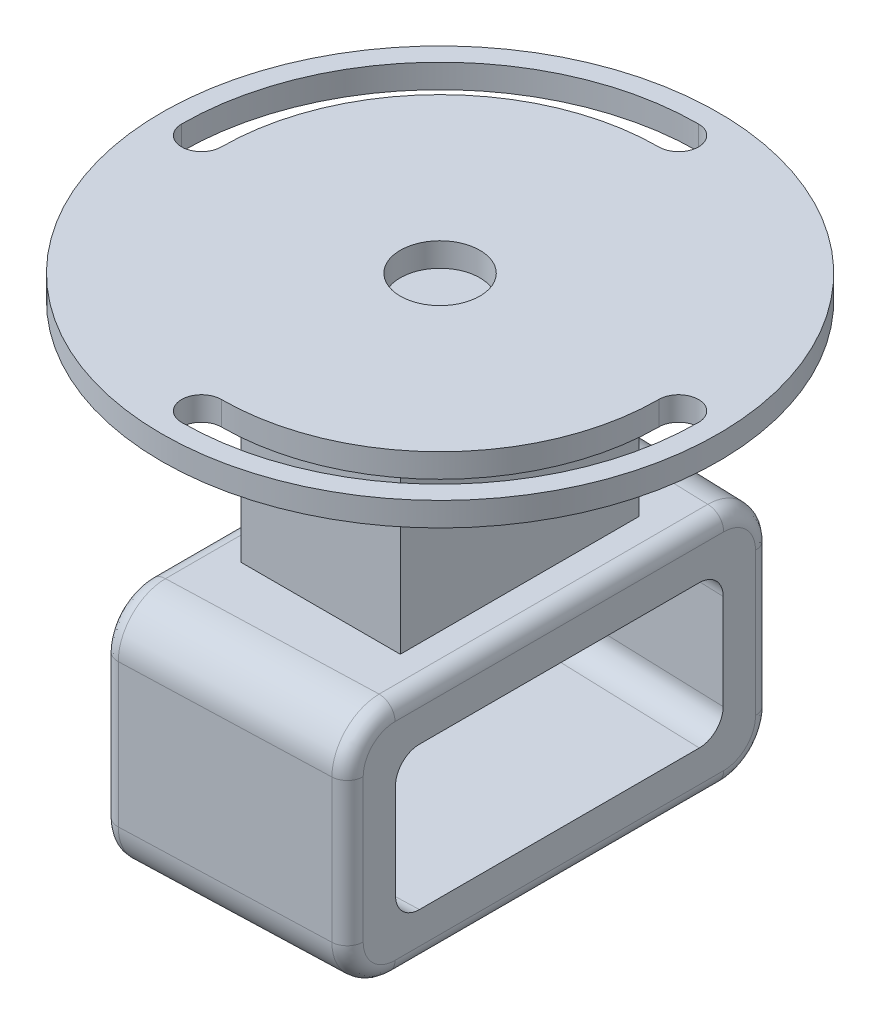
from build123d import *

# Parameters (mm, degrees)
SKETCH_1_R      = 35
SKETCH_1_R_2    = 5
EXTRUDE_1_DEPTH = 3
SKETCH_2_W      = 20
SKETCH_2_H      = 30
EXTRUDE_2_DEPTH = 26
EXTRUDE_4_DEPTH = 6
EXTRUDE_5_DEPTH = 30
EXTRUDE_START   = 30
EXTRUDE_6_DEPTH = 6
FILLET_1_R      = 3
FILLET_2_R      = 6
FILLET_3_R      = 2


with BuildPart() as part:
    # 스케치1 → 보스-돌출1 (new body)
    with BuildSketch(Plane(origin=(0, 0, 0), x_dir=(1, 0, 0), z_dir=(0, 1, 0))):
        with Locations(Location((0, 0, 0), (0, 0, 270))):
            Circle(SKETCH_1_R)
        with Locations(Location((0, 0, 0), (0, 0, 270))):
            Circle(SKETCH_1_R_2, mode=Mode.SUBTRACT)
        with BuildLine():
            ThreePointArc((0, 27.5), (2.5, 30), (0, 32.5))
            ThreePointArc((0, 32.5), (-22.980970389, 22.980970389), (-32.5, 0))
            ThreePointArc((-32.5, 0), (-30, -2.5), (-27.5, 0))
            ThreePointArc((-27.5, 0), (-19.445436483, 19.445436483), (0, 27.5))
        make_face(mode=Mode.SUBTRACT)
        with BuildLine():
            ThreePointArc((32.5, 0), (30, 2.5), (27.5, 0))
            ThreePointArc((27.5, 0), (19.445436483, -19.445436483), (0, -27.5))
            ThreePointArc((0, -27.5), (-2.5, -30), (0, -32.5))
            ThreePointArc((0, -32.5), (22.980970389, -22.980970389), (32.5, 0))
        make_face(mode=Mode.SUBTRACT)
    extrude(amount=EXTRUDE_1_DEPTH)

    # 스케치2 → 보스-돌출2 (add)
    with BuildSketch(Plane.XZ):
        Rectangle(SKETCH_2_W, SKETCH_2_H)
    extrude(amount=EXTRUDE_2_DEPTH)

    # 스케치5 → 보스-돌출4 (add)
    with BuildSketch(Plane.XZ.offset(26)):
        Polygon((15, 20.6), (15, -20.6), (-15, -21.6), (-15, 21.6), align=None)
    extrude(amount=EXTRUDE_4_DEPTH)

    # 스케치6 → 보스-돌출5 (add)
    with BuildSketch(Plane(origin=(0, -26, 0), x_dir=(1, 0, 0), z_dir=(0, 1, 0))):
        Polygon((-15, -21.6), (-15, -27.6), (15, -26.6), (15, -20.6), align=None)
        Polygon((-15, 21.6), (-15, 27.6), (15, 26.6), (15, 20.6), align=None)
    extrude(amount=-EXTRUDE_5_DEPTH)

    # 스케치5<2> → 보스-돌출6 (add)
    with BuildSketch(Plane.XZ.offset(26).offset(EXTRUDE_START)):
        Polygon((15, 20.6), (15, -20.6), (-15, -21.6), (-15, 21.6), align=None)
    extrude(amount=-EXTRUDE_6_DEPTH)

    # 필렛1
    fillet_1_edges = [part.edges().sort_by_distance(p)[0] for p in [
        (0, -32, 21.1),
        (0, -32, -21.1),
        (0, -50, -21.1),
        (0, -50, 21.1),
    ]]
    fillet(fillet_1_edges, radius=FILLET_1_R)

    # 필렛2
    fillet_2_edges = [part.edges().sort_by_distance(p)[0] for p in [
        (0, -56, 27.1),
        (0, -26, 27.1),
        (0, -56, -27.1),
        (0, -26, -27.1),
    ]]
    fillet(fillet_2_edges, radius=FILLET_2_R)

    # 필렛3
    fillet_3_edges = [part.edges().sort_by_distance(p)[0] for p in [
        (-15, -26, 0),
        (15, -26, 0),
        (15, -41, 26.6),
        (15, -56, 0),
        (15, -41, -26.6),
        (15, -54.243229575, 24.841075351),
        (15, -54.243229575, -24.841075351),
        (15, -27.756770425, -24.841075351),
        (15, -27.756770425, 24.841075351),
        (-15, -41, 27.6),
        (-15, -41, -27.6),
        (-15, -56, 0),
        (-15, -54.243229575, 25.841075351),
        (-15, -54.243229575, -25.841075351),
        (-15, -27.756770425, -25.841075351),
        (-15, -27.756770425, 25.841075351),
    ]]
    fillet(fillet_3_edges, radius=FILLET_3_R)


solid = part.part
